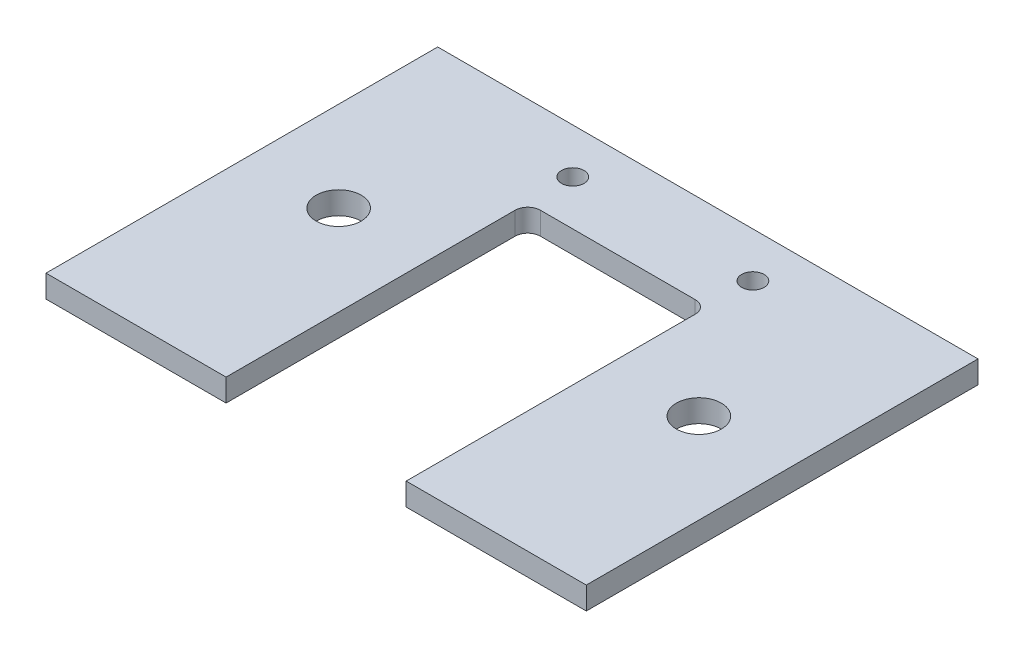
from build123d import *

# Parameters (mm, degrees)
SKETCH1_R           = 3.175
SKETCH1_R_2         = 1.5875
BOSS_EXTRUDE1_DEPTH = 3.175
FILLET1_R           = 1.778


with BuildPart() as part:
    # Sketch1 → Boss-Extrude1 (new body)
    with BuildSketch(Plane(origin=(0, 0, 0), x_dir=(1, 0, 0), z_dir=(0, 1, 0))):
        Polygon((38.1, 12.7), (-38.1, 12.7), (-38.1, -42.545), (-12.7, -42.545), (-12.7, 0), (12.7, 0), (12.7, -42.545), (38.1, -42.545), align=None)
        with Locations((-25.4, -13.97)):
            Circle(SKETCH1_R, mode=Mode.SUBTRACT)
        with Locations((25.4, -13.97)):
            Circle(SKETCH1_R, mode=Mode.SUBTRACT)
        with Locations((-12.7, 6.35)):
            Circle(SKETCH1_R_2, mode=Mode.SUBTRACT)
        with Locations((12.7, 6.35)):
            Circle(SKETCH1_R_2, mode=Mode.SUBTRACT)
    extrude(amount=BOSS_EXTRUDE1_DEPTH)

    # Fillet1
    fillet1_edges = [part.edges().sort_by_distance(p)[0] for p in [
        (12.7, 1.5875, 0),
        (-12.7, 1.5875, 0),
    ]]
    fillet(fillet1_edges, radius=FILLET1_R)


solid = part.part
